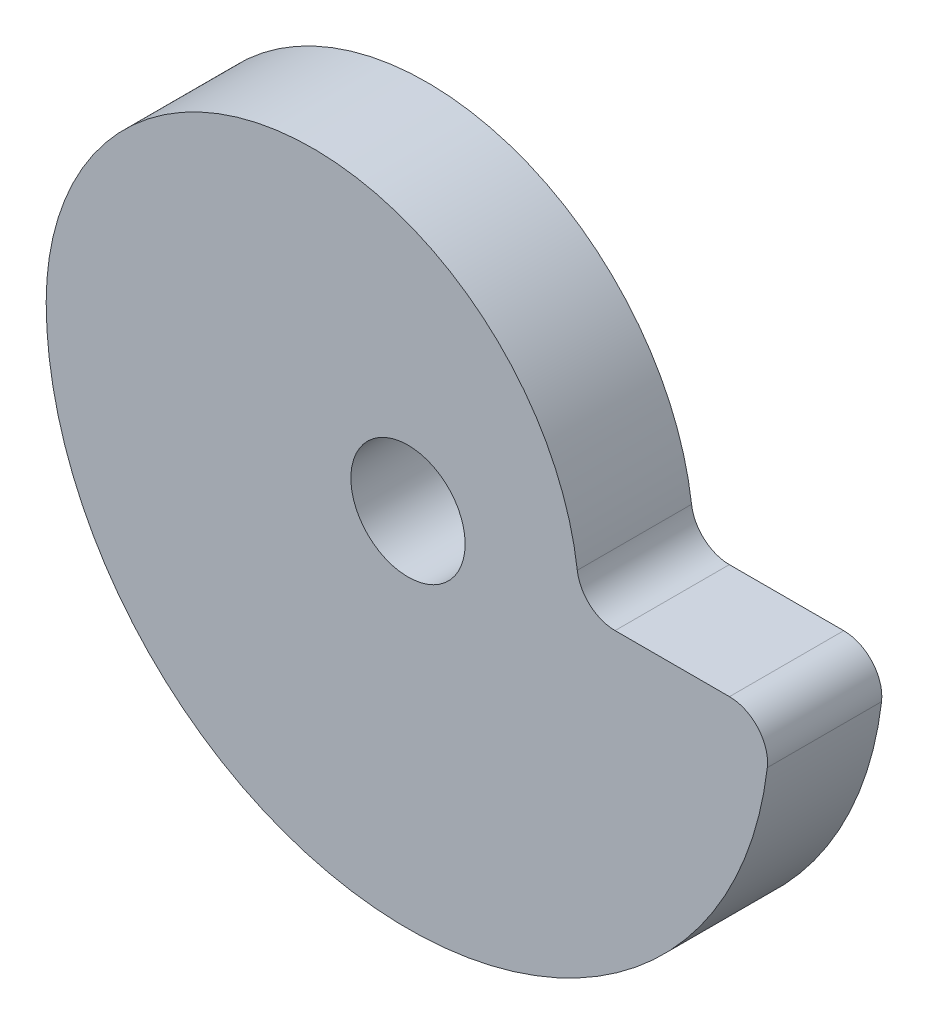
from build123d import *

# Parameters (mm, degrees)
SKETCH1_R           = 3
BOSS_EXTRUDE1_DEPTH = 3


with BuildPart() as part:
    # Sketch1 → Boss-Extrude1 (new, symmetric)
    with BuildSketch(Plane.XY):
        with BuildLine():
            Line((10.874507866, 0), (16.881943016, 0))
            ThreePointArc((16.881943016, 0), (18.377033019, -0.671577672), (18.868053959, -2.235294118))
            ThreePointArc((18.868053959, -2.235294118), (-1.11959251, -18.966984806), (-19, 0))
            ThreePointArc((-19, 0), (-5.876720776, 13.972521629), (8.890194383, 1.75))
            ThreePointArc((8.890194383, 1.75), (9.551632211, 0.5), (10.874507866, 0))
        make_face()
        Circle(SKETCH1_R, mode=Mode.SUBTRACT)
    extrude(amount=BOSS_EXTRUDE1_DEPTH, both=True)


solid = part.part
